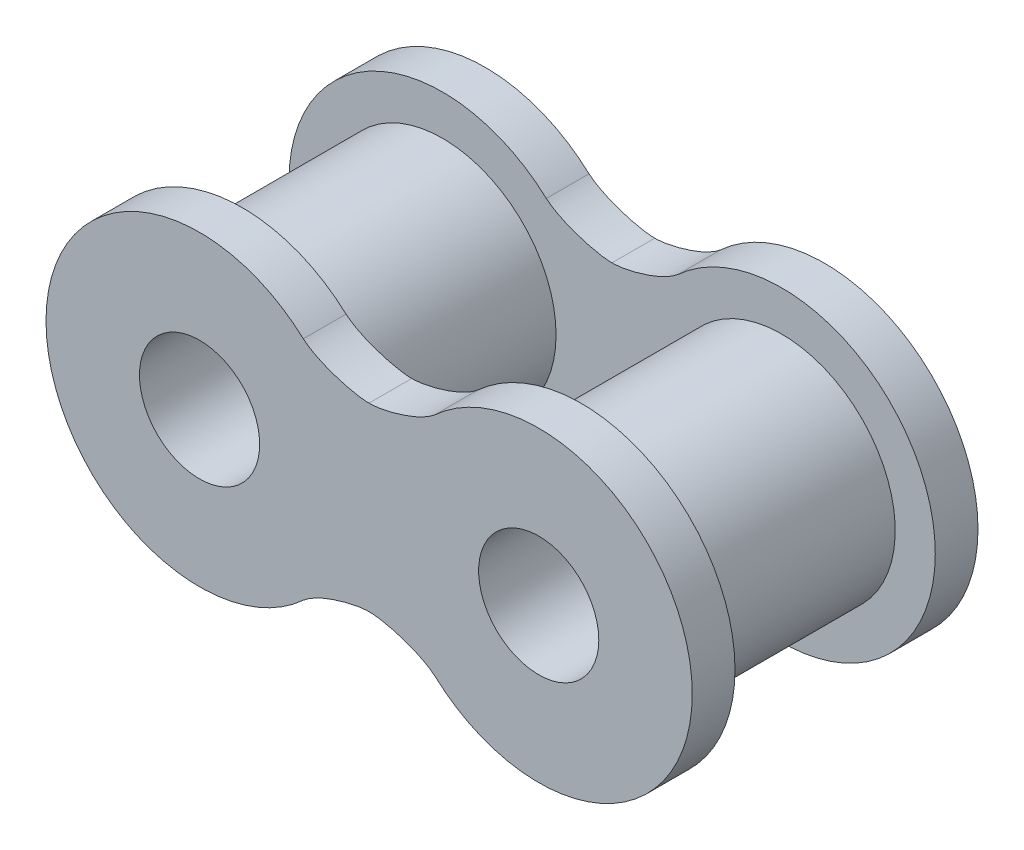
from build123d import *

# Parameters (mm, degrees)
SKETCH_1_R        = 4.25
SKETCH_1_R_2      = 2.25
EXTRUDE_1_DEPTH   = 3.75
EXTRUDE_1_2_DEPTH = 3.75
SKETCH_2_R        = 2.25
EXTRUDE_3_DEPTH   = 1.6


with BuildPart() as part:
    # 草图1 → 凸台-拉伸1 (new body)
    with BuildSketch(Plane.XY):
        with Locations((-6.35, 0)):
            Circle(SKETCH_1_R)
        with Locations((-6.35, 0)):
            Circle(SKETCH_1_R_2, mode=Mode.SUBTRACT)
    extrude_1 = extrude(amount=EXTRUDE_1_DEPTH)



with BuildPart() as body_2:
    # 草图1 → Extrude 1 2 (new body)
    with BuildSketch(Plane.XY):
        with Locations((6.35, 0)):
            Circle(SKETCH_1_R)
        with Locations((6.35, 0)):
            Circle(SKETCH_1_R_2, mode=Mode.SUBTRACT)
    extrude_1_2 = extrude(amount=EXTRUDE_1_2_DEPTH)


with BuildPart() as part_1:
    add(part.part)

    add(body_2.part)  # 凸台-拉伸3 merges body 2
    # 草图2 → 凸台-拉伸3 (add)
    with BuildSketch(Plane.XY.offset(3.75)):
        with BuildLine():
            ThreePointArc((-2.464522189, 4.238580208), (-12.1, 0), (-2.464522189, -4.238580208))
            add(Edge.make_bspline(
                [(-2.464522189, -4.238580208), (-1.801147303, -3.67793909), (-0.370790644, -3.34588107), (0, -3.386350938)],
                knots=[0, 0, 0, 0, 1, 1, 1, 1], degree=3))
            add(Edge.make_bspline(
                [(2.464522189, -4.238580208), (1.801147303, -3.67793909), (0.370790644, -3.34588107), (0, -3.386350938)],
                knots=[0, 0, 0, 0, 1, 1, 1, 1], degree=3))
            ThreePointArc((2.464522189, -4.238580208), (12.1, 0), (2.464522189, 4.238580208))
            add(Edge.make_bspline(
                [(2.464522189, 4.238580208), (1.801147303, 3.67793909), (0.370790644, 3.34588107), (0, 3.386350938)],
                knots=[0, 0, 0, 0, 1, 1, 1, 1], degree=3))
            add(Edge.make_bspline(
                [(-2.464522189, 4.238580208), (-1.801147303, 3.67793909), (-0.370790644, 3.34588107), (0, 3.386350938)],
                knots=[0, 0, 0, 0, 1, 1, 1, 1], degree=3))
        make_face()
        with Locations((-6.35, 0)):
            Circle(SKETCH_2_R, mode=Mode.SUBTRACT)
        with Locations((6.35, 0)):
            Circle(SKETCH_2_R, mode=Mode.SUBTRACT)
    extrude_3 = extrude(amount=EXTRUDE_3_DEPTH)

    # 镜向2: 凸台-拉伸1, Extrude 1 2, 凸台-拉伸3 across plane
    add(extrude_1.mirror(Plane(origin=(0, 0, 0), x_dir=(1, 0, 0), z_dir=(0, 0, -1))))
    add(extrude_1_2.mirror(Plane(origin=(0, 0, 0), x_dir=(1, 0, 0), z_dir=(0, 0, -1))))
    add(extrude_3.mirror(Plane(origin=(0, 0, 0), x_dir=(1, 0, 0), z_dir=(0, 0, -1))))


solid = part_1.part
